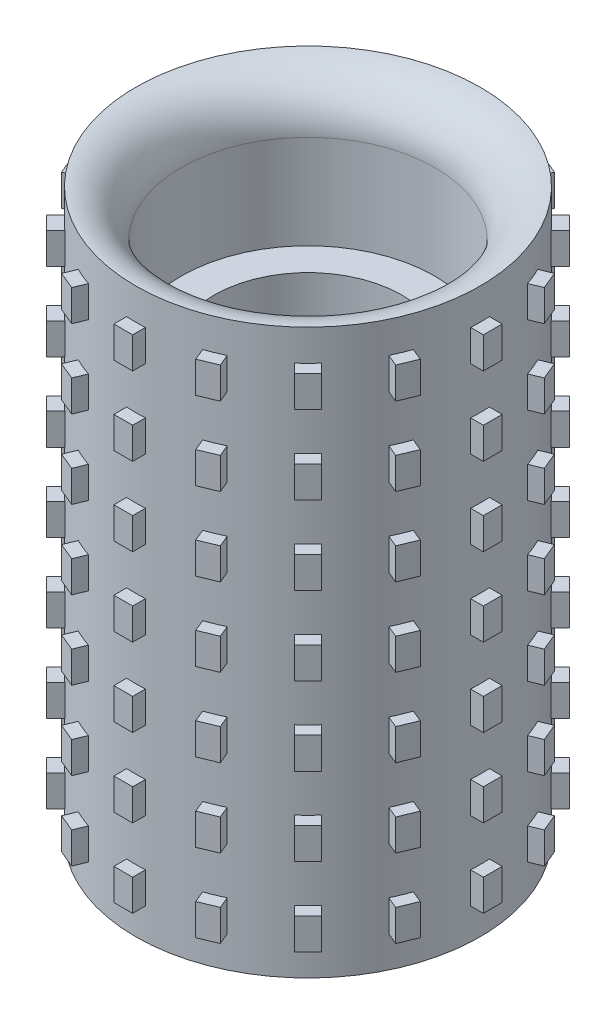
from build123d import *

# Parameters (mm, degrees)
SKETCH1_R            = 11
BOSS_EXTRUDE1_DEPTH  = 18
SKETCH2_R            = 6
CUT_EXTRUDE1_DEPTH   = 9
SKETCH3_R            = 8.1
CUT_EXTRUDE2_DEPTH   = 9
FILLET1_R            = 3
FILLET1_OF_MIRROR2_R = 3
BOSS_EXTRUDE2_DEPTH  = 1
LPATTERN2_COUNT      = 4
LPATTERN2_PITCH      = 5
MIRROR3_COPY_1_DEPTH = 1
MIRROR3_COPY_2_DEPTH = 1
MIRROR3_COPY_3_DEPTH = 1
MIRROR3_COPY_4_DEPTH = 1


with BuildPart() as part:
    # Sketch1 → Boss-Extrude1 (new, symmetric)
    with BuildSketch(Plane(origin=(0, 0, 0), x_dir=(1, 0, 0), z_dir=(0, 1, 0))):
        with Locations(Location((0, 0, 0), (0, 0, 270))):
            Circle(SKETCH1_R)
    extrude(amount=BOSS_EXTRUDE1_DEPTH, both=True)

    # Sketch2 → Cut-Extrude1 (cut, symmetric)
    with BuildSketch(Plane(origin=(0, 0, 0), x_dir=(1, 0, 0), z_dir=(0, 1, 0))):
        with Locations(Location((0, 0, 0), (0, 0, 270))):
            Circle(SKETCH2_R)
    extrude(amount=CUT_EXTRUDE1_DEPTH, both=True, mode=Mode.SUBTRACT)

    # Sketch3 → Cut-Extrude2 (cut)
    with BuildSketch(Plane.XZ.offset(18)):
        with Locations(Location((0, 0, 0), (0, 0, 270))):
            Circle(SKETCH3_R)
    cut_extrude2 = extrude(amount=-CUT_EXTRUDE2_DEPTH, mode=Mode.SUBTRACT)

    # Fillet1
    # the kernel refuses this fillet: 3 mm, written as the material it takes off along each edge
    with BuildSketch(Plane(origin=(0, -18, 0), x_dir=(-1.8e-16, 0, -1), z_dir=(-1, 0, 1.8e-16))) as fillet1_piece_1:
        with BuildLine():
            CenterArc((11.1, -2.998332870112989), FILLET1_R, 91.91021317170993, 88.08978682829007)
            Line((8.1, -2.998332870112989), (8.04, -2.998332870112989))
            Line((8.04, -2.998332870112989), (8.04, 0))
            Line((8.04, 0), (8.1, 0.05999999999999872))
            ThreePointArc((8.1, 0.05999999999999872), (9.55, 0.05999999999999872), (10.998, 0.05996665740225993))
            Line((10.998, 0.05996665740225993), (11, 0))
        make_face()
    revolve(axis=Axis((0, -18, 0), (0, -1, 0)), mode=Mode.SUBTRACT)

    # Mirror2: Cut-Extrude2 across plane
    add(cut_extrude2.mirror(Plane.ZX), mode=Mode.SUBTRACT)

    # Fillet1 of Mirror2
    # the kernel refuses this fillet: 3 mm, written as the material it takes off along each edge
    with BuildSketch(Plane(origin=(0, 18, 0), x_dir=(-1.8e-16, 0, -1), z_dir=(-1, 0, 1.8e-16))) as fillet1_of_mirror2_piece_1:
        with BuildLine():
            CenterArc((11.1, 2.998332870112989), FILLET1_OF_MIRROR2_R, 180, 88.08978682829007)
            Line((8.1, 2.998332870112989), (8.04, 2.998332870112989))
            Line((8.04, 2.998332870112989), (8.04, 0))
            Line((8.04, 0), (8.1, -0.05999999999999872))
            ThreePointArc((8.1, -0.05999999999999872), (9.55, -0.05999999999999872), (10.998, -0.05996665740225993))
            Line((10.998, -0.05996665740225993), (11, 0))
        make_face()
    revolve(axis=Axis((0, 18, 0), (0, -1, 0)), mode=Mode.SUBTRACT)

    # Sketch4 → Boss-Extrude2 (add, symmetric)
    with BuildSketch(Plane(origin=(0, 0, 0), x_dir=(1, 0, 0), z_dir=(0, 1, 0))):
        with BuildLine():
            Line((-0.6, 10.983624174196784), (-0.6, 11.799999999999999))
            Line((-0.6, 11.799999999999999), (0.6, 11.799999999999999))
            Line((0.6, 11.799999999999999), (0.6, 10.983624174196784))
            ThreePointArc((0.6, 10.983624174196784), (6.7e-16, 11), (-0.6, 10.983624174196784))
        make_face()
        with BuildLine():
            Line((3.648923279283037, 10.377155626755648), (3.961336782401297, 11.131388543052237))
            Line((3.961336782401297, 11.131388543052237), (5.069992221414841, 10.672168424214128))
            Line((5.069992221414841, 10.672168424214128), (4.757578718296581, 9.917935507917539))
            ThreePointArc((4.757578718296581, 9.917935507917539), (4.209517756015996, 10.162674857624156), (3.648923279283037, 10.377155626755648))
        make_face()
        with BuildLine():
            Line((7.342331066867124, 8.190859204290955), (7.919595949289347, 8.768124086713176))
            Line((7.919595949289347, 8.768124086713176), (8.7681240867132, 7.919595949289317))
            Line((8.7681240867132, 7.919595949289317), (8.190859204290982, 7.342331066867097))
            ThreePointArc((8.190859204290982, 7.342331066867097), (7.778174593052037, 7.778174593052011), (7.342331066867124, 8.190859204290955))
        make_face()
        with BuildLine():
            Line((9.917935507917552, 4.757578718296545), (10.672168424214142, 5.069992221414804))
            Line((10.672168424214142, 5.069992221414804), (11.131388543052248, 3.9613367824012578))
            Line((11.131388543052248, 3.9613367824012578), (10.377155626755657, 3.648923279283001))
            ThreePointArc((10.377155626755657, 3.648923279283001), (10.162674857624165, 4.20951775601596), (9.917935507917552, 4.757578718296545))
        make_face()
        with BuildLine():
            Line((10.983624174196786, 0.5999999999999616), (11.8, 0.5999999999999588))
            Line((11.8, 0.5999999999999588), (11.799999999999997, -0.6000000000000412))
            Line((11.799999999999997, -0.6000000000000412), (10.983624174196782, -0.6000000000000383))
            ThreePointArc((10.983624174196782, -0.6000000000000383), (11, -3.839e-14), (10.983624174196786, 0.5999999999999616))
        make_face()
        with BuildLine():
            Line((10.377155626755634, -3.6489232792830735), (11.131388543052221, -3.961336782401336))
            Line((11.131388543052221, -3.961336782401336), (10.672168424214108, -5.0699922214148785))
            Line((10.672168424214108, -5.0699922214148785), (9.917935507917521, -4.757578718296616))
            ThreePointArc((9.917935507917521, -4.757578718296616), (10.162674857624138, -4.209517756016032), (10.377155626755634, -3.6489232792830735))
        make_face()
        with BuildLine():
            Line((8.19085920429093, -7.342331066867154), (8.768124086713147, -7.91959594928938))
            Line((8.768124086713147, -7.91959594928938), (7.919595949289286, -8.76812408671323))
            Line((7.919595949289286, -8.76812408671323), (7.342331066867068, -8.190859204291005))
            ThreePointArc((7.342331066867068, -8.190859204291005), (7.778174593051982, -7.7781745930520625), (8.19085920429093, -7.342331066867154))
        make_face()
        with BuildLine():
            Line((4.757578718296511, -9.917935507917568), (5.069992221414766, -10.67216842421416))
            Line((5.069992221414766, -10.67216842421416), (3.9613367824012196, -11.131388543052262))
            Line((3.9613367824012196, -11.131388543052262), (3.6489232792829647, -10.377155626755671))
            ThreePointArc((3.6489232792829647, -10.377155626755671), (4.209517756015925, -10.16267485762418), (4.757578718296511, -9.917935507917568))
        make_face()
        with BuildLine():
            Line((0.599999999999923, -10.983624174196787), (0.5999999999999174, -11.800000000000002))
            Line((0.5999999999999174, -11.800000000000002), (-0.6000000000000826, -11.799999999999995))
            Line((-0.6000000000000826, -11.799999999999995), (-0.6000000000000768, -10.98362417419678))
            ThreePointArc((-0.6000000000000768, -10.98362417419678), (-7.749e-14, -11), (0.599999999999923, -10.983624174196787))
        make_face()
        with BuildLine():
            Line((-3.648923279283108, -10.377155626755611), (-3.961336782401373, -11.1313885430522))
            Line((-3.961336782401373, -11.1313885430522), (-5.069992221414914, -10.672168424214084))
            Line((-5.069992221414914, -10.672168424214084), (-4.7575787182966485, -9.917935507917495))
            ThreePointArc((-4.7575787182966485, -9.917935507917495), (-4.209517756016066, -10.162674857624115), (-3.648923279283108, -10.377155626755611))
        make_face()
        with BuildLine():
            Line((-7.342331066867183, -8.190859204290902), (-7.919595949289409, -8.768124086713119))
            Line((-7.919595949289409, -8.768124086713119), (-8.768124086713257, -7.919595949289253))
            Line((-8.768124086713257, -7.919595949289253), (-8.190859204291032, -7.342331066867038))
            ThreePointArc((-8.190859204291032, -7.342331066867038), (-7.77817459305209, -7.778174593051953), (-7.342331066867183, -8.190859204290902))
        make_face()
        with BuildLine():
            Line((-9.917935507917587, -4.757578718296473), (-10.672168424214183, -5.069992221414724))
            Line((-10.672168424214183, -5.069992221414724), (-11.131388543052278, -3.961336782401176))
            Line((-11.131388543052278, -3.961336782401176), (-10.377155626755682, -3.6489232792829247))
            ThreePointArc((-10.377155626755682, -3.6489232792829247), (-10.162674857624195, -4.2095177560158845), (-9.917935507917587, -4.757578718296473))
        make_face()
        with BuildLine():
            Line((-10.983624174196791, -0.599999999999885), (-11.800000000000006, -0.5999999999998763))
            Line((-11.800000000000006, -0.5999999999998763), (-11.799999999999994, 0.6000000000001235))
            Line((-11.799999999999994, 0.6000000000001235), (-10.983624174196777, 0.600000000000115))
            ThreePointArc((-10.983624174196777, 0.600000000000115), (-10.999999999999998, 1.1859e-13), (-10.983624174196791, -0.599999999999885))
        make_face()
        with BuildLine():
            Line((-10.377155626755608, 3.6489232792831374), (-11.131388543052195, 3.961336782401405))
            Line((-11.131388543052195, 3.961336782401405), (-10.672168424214075, 5.069992221414944))
            Line((-10.672168424214075, 5.069992221414944), (-9.91793550791749, 4.757578718296677))
            ThreePointArc((-9.91793550791749, 4.757578718296677), (-10.162674857624111, 4.209517756016092), (-10.377155626755608, 3.6489232792831374))
        make_face()
        with BuildLine():
            Line((-8.19085920429088, 7.342331066867211), (-8.768124086713094, 7.919595949289438))
            Line((-8.768124086713094, 7.919595949289438), (-7.919595949289225, 8.768124086713286))
            Line((-7.919595949289225, 8.768124086713286), (-7.342331066867012, 8.190859204291058))
            ThreePointArc((-7.342331066867012, 8.190859204291058), (-7.77817459305193, 7.7781745930521184), (-8.19085920429088, 7.342331066867211))
        make_face()
        with BuildLine():
            Line((-4.757578718296438, 9.917935507917607), (-5.069992221414687, 10.6721684242142))
            Line((-5.069992221414687, 10.6721684242142), (-3.961336782401137, 11.131388543052292))
            Line((-3.961336782401137, 11.131388543052292), (-3.6489232792828883, 10.377155626755698))
            ThreePointArc((-3.6489232792828883, 10.377155626755698), (-4.20951775601585, 10.162674857624213), (-4.757578718296438, 9.917935507917607))
        make_face()
    boss_extrude2 = extrude(amount=BOSS_EXTRUDE2_DEPTH, both=True)

    # LPattern2: Boss-Extrude2 ×4
    with Locations(*[(0, i * LPATTERN2_PITCH, 0) for i in range(1, LPATTERN2_COUNT)]):
        add(boss_extrude2)

    # Mirror3 copy 1 sketch → Mirror3 copy 1 (add, symmetric)
    with BuildSketch(Plane.XZ.offset(5)):
        with BuildLine():
            Line((-0.6, -10.983624174196784), (-0.6, -11.799999999999999))
            Line((-0.6, -11.799999999999999), (0.6, -11.799999999999999))
            Line((0.6, -11.799999999999999), (0.6, -10.983624174196784))
            ThreePointArc((0.6, -10.983624174196784), (6.7e-16, -11), (-0.6, -10.983624174196784))
        make_face()
        with BuildLine():
            Line((3.648923279283037, -10.377155626755648), (3.961336782401297, -11.131388543052237))
            Line((3.961336782401297, -11.131388543052237), (5.069992221414841, -10.672168424214128))
            Line((5.069992221414841, -10.672168424214128), (4.757578718296581, -9.917935507917539))
            ThreePointArc((4.757578718296581, -9.917935507917539), (4.209517756015996, -10.162674857624156), (3.648923279283037, -10.377155626755648))
        make_face()
        with BuildLine():
            Line((7.342331066867124, -8.190859204290955), (7.919595949289347, -8.768124086713176))
            Line((7.919595949289347, -8.768124086713176), (8.7681240867132, -7.919595949289317))
            Line((8.7681240867132, -7.919595949289317), (8.190859204290982, -7.342331066867097))
            ThreePointArc((8.190859204290982, -7.342331066867097), (7.778174593052037, -7.778174593052011), (7.342331066867124, -8.190859204290955))
        make_face()
        with BuildLine():
            Line((9.917935507917552, -4.757578718296545), (10.672168424214142, -5.069992221414804))
            Line((10.672168424214142, -5.069992221414804), (11.131388543052248, -3.9613367824012578))
            Line((11.131388543052248, -3.9613367824012578), (10.377155626755657, -3.648923279283001))
            ThreePointArc((10.377155626755657, -3.648923279283001), (10.162674857624165, -4.20951775601596), (9.917935507917552, -4.757578718296545))
        make_face()
        with BuildLine():
            Line((10.983624174196786, -0.5999999999999616), (11.8, -0.5999999999999588))
            Line((11.8, -0.5999999999999588), (11.799999999999997, 0.6000000000000412))
            Line((11.799999999999997, 0.6000000000000412), (10.983624174196782, 0.6000000000000383))
            ThreePointArc((10.983624174196782, 0.6000000000000383), (11, 3.839e-14), (10.983624174196786, -0.5999999999999616))
        make_face()
        with BuildLine():
            Line((10.377155626755634, 3.6489232792830735), (11.131388543052221, 3.961336782401336))
            Line((11.131388543052221, 3.961336782401336), (10.672168424214108, 5.0699922214148785))
            Line((10.672168424214108, 5.0699922214148785), (9.917935507917521, 4.757578718296616))
            ThreePointArc((9.917935507917521, 4.757578718296616), (10.162674857624138, 4.209517756016032), (10.377155626755634, 3.6489232792830735))
        make_face()
        with BuildLine():
            Line((8.19085920429093, 7.342331066867154), (8.768124086713147, 7.91959594928938))
            Line((8.768124086713147, 7.91959594928938), (7.919595949289286, 8.76812408671323))
            Line((7.919595949289286, 8.76812408671323), (7.342331066867068, 8.190859204291005))
            ThreePointArc((7.342331066867068, 8.190859204291005), (7.778174593051982, 7.7781745930520625), (8.19085920429093, 7.342331066867154))
        make_face()
        with BuildLine():
            Line((4.757578718296511, 9.917935507917568), (5.069992221414766, 10.67216842421416))
            Line((5.069992221414766, 10.67216842421416), (3.9613367824012196, 11.131388543052262))
            Line((3.9613367824012196, 11.131388543052262), (3.6489232792829647, 10.377155626755671))
            ThreePointArc((3.6489232792829647, 10.377155626755671), (4.209517756015925, 10.16267485762418), (4.757578718296511, 9.917935507917568))
        make_face()
        with BuildLine():
            Line((0.599999999999923, 10.983624174196787), (0.5999999999999174, 11.800000000000002))
            Line((0.5999999999999174, 11.800000000000002), (-0.6000000000000826, 11.799999999999995))
            Line((-0.6000000000000826, 11.799999999999995), (-0.6000000000000768, 10.98362417419678))
            ThreePointArc((-0.6000000000000768, 10.98362417419678), (-7.749e-14, 11), (0.599999999999923, 10.983624174196787))
        make_face()
        with BuildLine():
            Line((-3.648923279283108, 10.377155626755611), (-3.961336782401373, 11.1313885430522))
            Line((-3.961336782401373, 11.1313885430522), (-5.069992221414914, 10.672168424214084))
            Line((-5.069992221414914, 10.672168424214084), (-4.7575787182966485, 9.917935507917495))
            ThreePointArc((-4.7575787182966485, 9.917935507917495), (-4.209517756016066, 10.162674857624115), (-3.648923279283108, 10.377155626755611))
        make_face()
        with BuildLine():
            Line((-7.342331066867183, 8.190859204290902), (-7.919595949289409, 8.768124086713119))
            Line((-7.919595949289409, 8.768124086713119), (-8.768124086713257, 7.919595949289253))
            Line((-8.768124086713257, 7.919595949289253), (-8.190859204291032, 7.342331066867038))
            ThreePointArc((-8.190859204291032, 7.342331066867038), (-7.77817459305209, 7.778174593051953), (-7.342331066867183, 8.190859204290902))
        make_face()
        with BuildLine():
            Line((-9.917935507917587, 4.757578718296473), (-10.672168424214183, 5.069992221414724))
            Line((-10.672168424214183, 5.069992221414724), (-11.131388543052278, 3.961336782401176))
            Line((-11.131388543052278, 3.961336782401176), (-10.377155626755682, 3.6489232792829247))
            ThreePointArc((-10.377155626755682, 3.6489232792829247), (-10.162674857624195, 4.2095177560158845), (-9.917935507917587, 4.757578718296473))
        make_face()
        with BuildLine():
            Line((-10.983624174196791, 0.599999999999885), (-11.800000000000006, 0.5999999999998763))
            Line((-11.800000000000006, 0.5999999999998763), (-11.799999999999994, -0.6000000000001235))
            Line((-11.799999999999994, -0.6000000000001235), (-10.983624174196777, -0.600000000000115))
            ThreePointArc((-10.983624174196777, -0.600000000000115), (-10.999999999999998, -1.1859e-13), (-10.983624174196791, 0.599999999999885))
        make_face()
        with BuildLine():
            Line((-10.377155626755608, -3.6489232792831374), (-11.131388543052195, -3.961336782401405))
            Line((-11.131388543052195, -3.961336782401405), (-10.672168424214075, -5.069992221414944))
            Line((-10.672168424214075, -5.069992221414944), (-9.91793550791749, -4.757578718296677))
            ThreePointArc((-9.91793550791749, -4.757578718296677), (-10.162674857624111, -4.209517756016092), (-10.377155626755608, -3.6489232792831374))
        make_face()
        with BuildLine():
            Line((-8.19085920429088, -7.342331066867211), (-8.768124086713094, -7.919595949289438))
            Line((-8.768124086713094, -7.919595949289438), (-7.919595949289225, -8.768124086713286))
            Line((-7.919595949289225, -8.768124086713286), (-7.342331066867012, -8.190859204291058))
            ThreePointArc((-7.342331066867012, -8.190859204291058), (-7.77817459305193, -7.7781745930521184), (-8.19085920429088, -7.342331066867211))
        make_face()
        with BuildLine():
            Line((-4.757578718296438, -9.917935507917607), (-5.069992221414687, -10.6721684242142))
            Line((-5.069992221414687, -10.6721684242142), (-3.961336782401137, -11.131388543052292))
            Line((-3.961336782401137, -11.131388543052292), (-3.6489232792828883, -10.377155626755698))
            ThreePointArc((-3.6489232792828883, -10.377155626755698), (-4.20951775601585, -10.162674857624213), (-4.757578718296438, -9.917935507917607))
        make_face()
    extrude(amount=MIRROR3_COPY_1_DEPTH, both=True)

    # Mirror3 copy 2 sketch → Mirror3 copy 2 (add, symmetric)
    with BuildSketch(Plane.XZ.offset(10)):
        with BuildLine():
            Line((-0.6, -10.983624174196784), (-0.6, -11.799999999999999))
            Line((-0.6, -11.799999999999999), (0.6, -11.799999999999999))
            Line((0.6, -11.799999999999999), (0.6, -10.983624174196784))
            ThreePointArc((0.6, -10.983624174196784), (6.7e-16, -11), (-0.6, -10.983624174196784))
        make_face()
        with BuildLine():
            Line((3.648923279283037, -10.377155626755648), (3.961336782401297, -11.131388543052237))
            Line((3.961336782401297, -11.131388543052237), (5.069992221414841, -10.672168424214128))
            Line((5.069992221414841, -10.672168424214128), (4.757578718296581, -9.917935507917539))
            ThreePointArc((4.757578718296581, -9.917935507917539), (4.209517756015996, -10.162674857624156), (3.648923279283037, -10.377155626755648))
        make_face()
        with BuildLine():
            Line((7.342331066867124, -8.190859204290955), (7.919595949289347, -8.768124086713176))
            Line((7.919595949289347, -8.768124086713176), (8.7681240867132, -7.919595949289317))
            Line((8.7681240867132, -7.919595949289317), (8.190859204290982, -7.342331066867097))
            ThreePointArc((8.190859204290982, -7.342331066867097), (7.778174593052037, -7.778174593052011), (7.342331066867124, -8.190859204290955))
        make_face()
        with BuildLine():
            Line((9.917935507917552, -4.757578718296545), (10.672168424214142, -5.069992221414804))
            Line((10.672168424214142, -5.069992221414804), (11.131388543052248, -3.9613367824012578))
            Line((11.131388543052248, -3.9613367824012578), (10.377155626755657, -3.648923279283001))
            ThreePointArc((10.377155626755657, -3.648923279283001), (10.162674857624165, -4.20951775601596), (9.917935507917552, -4.757578718296545))
        make_face()
        with BuildLine():
            Line((10.983624174196786, -0.5999999999999616), (11.8, -0.5999999999999588))
            Line((11.8, -0.5999999999999588), (11.799999999999997, 0.6000000000000412))
            Line((11.799999999999997, 0.6000000000000412), (10.983624174196782, 0.6000000000000383))
            ThreePointArc((10.983624174196782, 0.6000000000000383), (11, 3.839e-14), (10.983624174196786, -0.5999999999999616))
        make_face()
        with BuildLine():
            Line((10.377155626755634, 3.6489232792830735), (11.131388543052221, 3.961336782401336))
            Line((11.131388543052221, 3.961336782401336), (10.672168424214108, 5.0699922214148785))
            Line((10.672168424214108, 5.0699922214148785), (9.917935507917521, 4.757578718296616))
            ThreePointArc((9.917935507917521, 4.757578718296616), (10.162674857624138, 4.209517756016032), (10.377155626755634, 3.6489232792830735))
        make_face()
        with BuildLine():
            Line((8.19085920429093, 7.342331066867154), (8.768124086713147, 7.91959594928938))
            Line((8.768124086713147, 7.91959594928938), (7.919595949289286, 8.76812408671323))
            Line((7.919595949289286, 8.76812408671323), (7.342331066867068, 8.190859204291005))
            ThreePointArc((7.342331066867068, 8.190859204291005), (7.778174593051982, 7.7781745930520625), (8.19085920429093, 7.342331066867154))
        make_face()
        with BuildLine():
            Line((4.757578718296511, 9.917935507917568), (5.069992221414766, 10.67216842421416))
            Line((5.069992221414766, 10.67216842421416), (3.9613367824012196, 11.131388543052262))
            Line((3.9613367824012196, 11.131388543052262), (3.6489232792829647, 10.377155626755671))
            ThreePointArc((3.6489232792829647, 10.377155626755671), (4.209517756015925, 10.16267485762418), (4.757578718296511, 9.917935507917568))
        make_face()
        with BuildLine():
            Line((0.599999999999923, 10.983624174196787), (0.5999999999999174, 11.800000000000002))
            Line((0.5999999999999174, 11.800000000000002), (-0.6000000000000826, 11.799999999999995))
            Line((-0.6000000000000826, 11.799999999999995), (-0.6000000000000768, 10.98362417419678))
            ThreePointArc((-0.6000000000000768, 10.98362417419678), (-7.749e-14, 11), (0.599999999999923, 10.983624174196787))
        make_face()
        with BuildLine():
            Line((-3.648923279283108, 10.377155626755611), (-3.961336782401373, 11.1313885430522))
            Line((-3.961336782401373, 11.1313885430522), (-5.069992221414914, 10.672168424214084))
            Line((-5.069992221414914, 10.672168424214084), (-4.7575787182966485, 9.917935507917495))
            ThreePointArc((-4.7575787182966485, 9.917935507917495), (-4.209517756016066, 10.162674857624115), (-3.648923279283108, 10.377155626755611))
        make_face()
        with BuildLine():
            Line((-7.342331066867183, 8.190859204290902), (-7.919595949289409, 8.768124086713119))
            Line((-7.919595949289409, 8.768124086713119), (-8.768124086713257, 7.919595949289253))
            Line((-8.768124086713257, 7.919595949289253), (-8.190859204291032, 7.342331066867038))
            ThreePointArc((-8.190859204291032, 7.342331066867038), (-7.77817459305209, 7.778174593051953), (-7.342331066867183, 8.190859204290902))
        make_face()
        with BuildLine():
            Line((-9.917935507917587, 4.757578718296473), (-10.672168424214183, 5.069992221414724))
            Line((-10.672168424214183, 5.069992221414724), (-11.131388543052278, 3.961336782401176))
            Line((-11.131388543052278, 3.961336782401176), (-10.377155626755682, 3.6489232792829247))
            ThreePointArc((-10.377155626755682, 3.6489232792829247), (-10.162674857624195, 4.2095177560158845), (-9.917935507917587, 4.757578718296473))
        make_face()
        with BuildLine():
            Line((-10.983624174196791, 0.599999999999885), (-11.800000000000006, 0.5999999999998763))
            Line((-11.800000000000006, 0.5999999999998763), (-11.799999999999994, -0.6000000000001235))
            Line((-11.799999999999994, -0.6000000000001235), (-10.983624174196777, -0.600000000000115))
            ThreePointArc((-10.983624174196777, -0.600000000000115), (-10.999999999999998, -1.1859e-13), (-10.983624174196791, 0.599999999999885))
        make_face()
        with BuildLine():
            Line((-10.377155626755608, -3.6489232792831374), (-11.131388543052195, -3.961336782401405))
            Line((-11.131388543052195, -3.961336782401405), (-10.672168424214075, -5.069992221414944))
            Line((-10.672168424214075, -5.069992221414944), (-9.91793550791749, -4.757578718296677))
            ThreePointArc((-9.91793550791749, -4.757578718296677), (-10.162674857624111, -4.209517756016092), (-10.377155626755608, -3.6489232792831374))
        make_face()
        with BuildLine():
            Line((-8.19085920429088, -7.342331066867211), (-8.768124086713094, -7.919595949289438))
            Line((-8.768124086713094, -7.919595949289438), (-7.919595949289225, -8.768124086713286))
            Line((-7.919595949289225, -8.768124086713286), (-7.342331066867012, -8.190859204291058))
            ThreePointArc((-7.342331066867012, -8.190859204291058), (-7.77817459305193, -7.7781745930521184), (-8.19085920429088, -7.342331066867211))
        make_face()
        with BuildLine():
            Line((-4.757578718296438, -9.917935507917607), (-5.069992221414687, -10.6721684242142))
            Line((-5.069992221414687, -10.6721684242142), (-3.961336782401137, -11.131388543052292))
            Line((-3.961336782401137, -11.131388543052292), (-3.6489232792828883, -10.377155626755698))
            ThreePointArc((-3.6489232792828883, -10.377155626755698), (-4.20951775601585, -10.162674857624213), (-4.757578718296438, -9.917935507917607))
        make_face()
    extrude(amount=MIRROR3_COPY_2_DEPTH, both=True)

    # Mirror3 copy 3 sketch → Mirror3 copy 3 (add, symmetric)
    with BuildSketch(Plane.XZ.offset(15)):
        with BuildLine():
            Line((-0.6, -10.983624174196784), (-0.6, -11.799999999999999))
            Line((-0.6, -11.799999999999999), (0.6, -11.799999999999999))
            Line((0.6, -11.799999999999999), (0.6, -10.983624174196784))
            ThreePointArc((0.6, -10.983624174196784), (6.7e-16, -11), (-0.6, -10.983624174196784))
        make_face()
        with BuildLine():
            Line((3.648923279283037, -10.377155626755648), (3.961336782401297, -11.131388543052237))
            Line((3.961336782401297, -11.131388543052237), (5.069992221414841, -10.672168424214128))
            Line((5.069992221414841, -10.672168424214128), (4.757578718296581, -9.917935507917539))
            ThreePointArc((4.757578718296581, -9.917935507917539), (4.209517756015996, -10.162674857624156), (3.648923279283037, -10.377155626755648))
        make_face()
        with BuildLine():
            Line((7.342331066867124, -8.190859204290955), (7.919595949289347, -8.768124086713176))
            Line((7.919595949289347, -8.768124086713176), (8.7681240867132, -7.919595949289317))
            Line((8.7681240867132, -7.919595949289317), (8.190859204290982, -7.342331066867097))
            ThreePointArc((8.190859204290982, -7.342331066867097), (7.778174593052037, -7.778174593052011), (7.342331066867124, -8.190859204290955))
        make_face()
        with BuildLine():
            Line((9.917935507917552, -4.757578718296545), (10.672168424214142, -5.069992221414804))
            Line((10.672168424214142, -5.069992221414804), (11.131388543052248, -3.9613367824012578))
            Line((11.131388543052248, -3.9613367824012578), (10.377155626755657, -3.648923279283001))
            ThreePointArc((10.377155626755657, -3.648923279283001), (10.162674857624165, -4.20951775601596), (9.917935507917552, -4.757578718296545))
        make_face()
        with BuildLine():
            Line((10.983624174196786, -0.5999999999999616), (11.8, -0.5999999999999588))
            Line((11.8, -0.5999999999999588), (11.799999999999997, 0.6000000000000412))
            Line((11.799999999999997, 0.6000000000000412), (10.983624174196782, 0.6000000000000383))
            ThreePointArc((10.983624174196782, 0.6000000000000383), (11, 3.839e-14), (10.983624174196786, -0.5999999999999616))
        make_face()
        with BuildLine():
            Line((10.377155626755634, 3.6489232792830735), (11.131388543052221, 3.961336782401336))
            Line((11.131388543052221, 3.961336782401336), (10.672168424214108, 5.0699922214148785))
            Line((10.672168424214108, 5.0699922214148785), (9.917935507917521, 4.757578718296616))
            ThreePointArc((9.917935507917521, 4.757578718296616), (10.162674857624138, 4.209517756016032), (10.377155626755634, 3.6489232792830735))
        make_face()
        with BuildLine():
            Line((8.19085920429093, 7.342331066867154), (8.768124086713147, 7.91959594928938))
            Line((8.768124086713147, 7.91959594928938), (7.919595949289286, 8.76812408671323))
            Line((7.919595949289286, 8.76812408671323), (7.342331066867068, 8.190859204291005))
            ThreePointArc((7.342331066867068, 8.190859204291005), (7.778174593051982, 7.7781745930520625), (8.19085920429093, 7.342331066867154))
        make_face()
        with BuildLine():
            Line((4.757578718296511, 9.917935507917568), (5.069992221414766, 10.67216842421416))
            Line((5.069992221414766, 10.67216842421416), (3.9613367824012196, 11.131388543052262))
            Line((3.9613367824012196, 11.131388543052262), (3.6489232792829647, 10.377155626755671))
            ThreePointArc((3.6489232792829647, 10.377155626755671), (4.209517756015925, 10.16267485762418), (4.757578718296511, 9.917935507917568))
        make_face()
        with BuildLine():
            Line((0.599999999999923, 10.983624174196787), (0.5999999999999174, 11.800000000000002))
            Line((0.5999999999999174, 11.800000000000002), (-0.6000000000000826, 11.799999999999995))
            Line((-0.6000000000000826, 11.799999999999995), (-0.6000000000000768, 10.98362417419678))
            ThreePointArc((-0.6000000000000768, 10.98362417419678), (-7.749e-14, 11), (0.599999999999923, 10.983624174196787))
        make_face()
        with BuildLine():
            Line((-3.648923279283108, 10.377155626755611), (-3.961336782401373, 11.1313885430522))
            Line((-3.961336782401373, 11.1313885430522), (-5.069992221414914, 10.672168424214084))
            Line((-5.069992221414914, 10.672168424214084), (-4.7575787182966485, 9.917935507917495))
            ThreePointArc((-4.7575787182966485, 9.917935507917495), (-4.209517756016066, 10.162674857624115), (-3.648923279283108, 10.377155626755611))
        make_face()
        with BuildLine():
            Line((-7.342331066867183, 8.190859204290902), (-7.919595949289409, 8.768124086713119))
            Line((-7.919595949289409, 8.768124086713119), (-8.768124086713257, 7.919595949289253))
            Line((-8.768124086713257, 7.919595949289253), (-8.190859204291032, 7.342331066867038))
            ThreePointArc((-8.190859204291032, 7.342331066867038), (-7.77817459305209, 7.778174593051953), (-7.342331066867183, 8.190859204290902))
        make_face()
        with BuildLine():
            Line((-9.917935507917587, 4.757578718296473), (-10.672168424214183, 5.069992221414724))
            Line((-10.672168424214183, 5.069992221414724), (-11.131388543052278, 3.961336782401176))
            Line((-11.131388543052278, 3.961336782401176), (-10.377155626755682, 3.6489232792829247))
            ThreePointArc((-10.377155626755682, 3.6489232792829247), (-10.162674857624195, 4.2095177560158845), (-9.917935507917587, 4.757578718296473))
        make_face()
        with BuildLine():
            Line((-10.983624174196791, 0.599999999999885), (-11.800000000000006, 0.5999999999998763))
            Line((-11.800000000000006, 0.5999999999998763), (-11.799999999999994, -0.6000000000001235))
            Line((-11.799999999999994, -0.6000000000001235), (-10.983624174196777, -0.600000000000115))
            ThreePointArc((-10.983624174196777, -0.600000000000115), (-10.999999999999998, -1.1859e-13), (-10.983624174196791, 0.599999999999885))
        make_face()
        with BuildLine():
            Line((-10.377155626755608, -3.6489232792831374), (-11.131388543052195, -3.961336782401405))
            Line((-11.131388543052195, -3.961336782401405), (-10.672168424214075, -5.069992221414944))
            Line((-10.672168424214075, -5.069992221414944), (-9.91793550791749, -4.757578718296677))
            ThreePointArc((-9.91793550791749, -4.757578718296677), (-10.162674857624111, -4.209517756016092), (-10.377155626755608, -3.6489232792831374))
        make_face()
        with BuildLine():
            Line((-8.19085920429088, -7.342331066867211), (-8.768124086713094, -7.919595949289438))
            Line((-8.768124086713094, -7.919595949289438), (-7.919595949289225, -8.768124086713286))
            Line((-7.919595949289225, -8.768124086713286), (-7.342331066867012, -8.190859204291058))
            ThreePointArc((-7.342331066867012, -8.190859204291058), (-7.77817459305193, -7.7781745930521184), (-8.19085920429088, -7.342331066867211))
        make_face()
        with BuildLine():
            Line((-4.757578718296438, -9.917935507917607), (-5.069992221414687, -10.6721684242142))
            Line((-5.069992221414687, -10.6721684242142), (-3.961336782401137, -11.131388543052292))
            Line((-3.961336782401137, -11.131388543052292), (-3.6489232792828883, -10.377155626755698))
            ThreePointArc((-3.6489232792828883, -10.377155626755698), (-4.20951775601585, -10.162674857624213), (-4.757578718296438, -9.917935507917607))
        make_face()
    extrude(amount=MIRROR3_COPY_3_DEPTH, both=True)

    # Mirror3 copy 4 sketch → Mirror3 copy 4 (add, symmetric)
    with BuildSketch(Plane.XZ):
        with BuildLine():
            Line((-0.6, -10.983624174196784), (-0.6, -11.799999999999999))
            Line((-0.6, -11.799999999999999), (0.6, -11.799999999999999))
            Line((0.6, -11.799999999999999), (0.6, -10.983624174196784))
            ThreePointArc((0.6, -10.983624174196784), (6.7e-16, -11), (-0.6, -10.983624174196784))
        make_face()
        with BuildLine():
            Line((3.648923279283037, -10.377155626755648), (3.961336782401297, -11.131388543052237))
            Line((3.961336782401297, -11.131388543052237), (5.069992221414841, -10.672168424214128))
            Line((5.069992221414841, -10.672168424214128), (4.757578718296581, -9.917935507917539))
            ThreePointArc((4.757578718296581, -9.917935507917539), (4.209517756015996, -10.162674857624156), (3.648923279283037, -10.377155626755648))
        make_face()
        with BuildLine():
            Line((7.342331066867124, -8.190859204290955), (7.919595949289347, -8.768124086713176))
            Line((7.919595949289347, -8.768124086713176), (8.7681240867132, -7.919595949289317))
            Line((8.7681240867132, -7.919595949289317), (8.190859204290982, -7.342331066867097))
            ThreePointArc((8.190859204290982, -7.342331066867097), (7.778174593052037, -7.778174593052011), (7.342331066867124, -8.190859204290955))
        make_face()
        with BuildLine():
            Line((9.917935507917552, -4.757578718296545), (10.672168424214142, -5.069992221414804))
            Line((10.672168424214142, -5.069992221414804), (11.131388543052248, -3.9613367824012578))
            Line((11.131388543052248, -3.9613367824012578), (10.377155626755657, -3.648923279283001))
            ThreePointArc((10.377155626755657, -3.648923279283001), (10.162674857624165, -4.20951775601596), (9.917935507917552, -4.757578718296545))
        make_face()
        with BuildLine():
            Line((10.983624174196786, -0.5999999999999616), (11.8, -0.5999999999999588))
            Line((11.8, -0.5999999999999588), (11.799999999999997, 0.6000000000000412))
            Line((11.799999999999997, 0.6000000000000412), (10.983624174196782, 0.6000000000000383))
            ThreePointArc((10.983624174196782, 0.6000000000000383), (11, 3.839e-14), (10.983624174196786, -0.5999999999999616))
        make_face()
        with BuildLine():
            Line((10.377155626755634, 3.6489232792830735), (11.131388543052221, 3.961336782401336))
            Line((11.131388543052221, 3.961336782401336), (10.672168424214108, 5.0699922214148785))
            Line((10.672168424214108, 5.0699922214148785), (9.917935507917521, 4.757578718296616))
            ThreePointArc((9.917935507917521, 4.757578718296616), (10.162674857624138, 4.209517756016032), (10.377155626755634, 3.6489232792830735))
        make_face()
        with BuildLine():
            Line((8.19085920429093, 7.342331066867154), (8.768124086713147, 7.91959594928938))
            Line((8.768124086713147, 7.91959594928938), (7.919595949289286, 8.76812408671323))
            Line((7.919595949289286, 8.76812408671323), (7.342331066867068, 8.190859204291005))
            ThreePointArc((7.342331066867068, 8.190859204291005), (7.778174593051982, 7.7781745930520625), (8.19085920429093, 7.342331066867154))
        make_face()
        with BuildLine():
            Line((4.757578718296511, 9.917935507917568), (5.069992221414766, 10.67216842421416))
            Line((5.069992221414766, 10.67216842421416), (3.9613367824012196, 11.131388543052262))
            Line((3.9613367824012196, 11.131388543052262), (3.6489232792829647, 10.377155626755671))
            ThreePointArc((3.6489232792829647, 10.377155626755671), (4.209517756015925, 10.16267485762418), (4.757578718296511, 9.917935507917568))
        make_face()
        with BuildLine():
            Line((0.599999999999923, 10.983624174196787), (0.5999999999999174, 11.800000000000002))
            Line((0.5999999999999174, 11.800000000000002), (-0.6000000000000826, 11.799999999999995))
            Line((-0.6000000000000826, 11.799999999999995), (-0.6000000000000768, 10.98362417419678))
            ThreePointArc((-0.6000000000000768, 10.98362417419678), (-7.749e-14, 11), (0.599999999999923, 10.983624174196787))
        make_face()
        with BuildLine():
            Line((-3.648923279283108, 10.377155626755611), (-3.961336782401373, 11.1313885430522))
            Line((-3.961336782401373, 11.1313885430522), (-5.069992221414914, 10.672168424214084))
            Line((-5.069992221414914, 10.672168424214084), (-4.7575787182966485, 9.917935507917495))
            ThreePointArc((-4.7575787182966485, 9.917935507917495), (-4.209517756016066, 10.162674857624115), (-3.648923279283108, 10.377155626755611))
        make_face()
        with BuildLine():
            Line((-7.342331066867183, 8.190859204290902), (-7.919595949289409, 8.768124086713119))
            Line((-7.919595949289409, 8.768124086713119), (-8.768124086713257, 7.919595949289253))
            Line((-8.768124086713257, 7.919595949289253), (-8.190859204291032, 7.342331066867038))
            ThreePointArc((-8.190859204291032, 7.342331066867038), (-7.77817459305209, 7.778174593051953), (-7.342331066867183, 8.190859204290902))
        make_face()
        with BuildLine():
            Line((-9.917935507917587, 4.757578718296473), (-10.672168424214183, 5.069992221414724))
            Line((-10.672168424214183, 5.069992221414724), (-11.131388543052278, 3.961336782401176))
            Line((-11.131388543052278, 3.961336782401176), (-10.377155626755682, 3.6489232792829247))
            ThreePointArc((-10.377155626755682, 3.6489232792829247), (-10.162674857624195, 4.2095177560158845), (-9.917935507917587, 4.757578718296473))
        make_face()
        with BuildLine():
            Line((-10.983624174196791, 0.599999999999885), (-11.800000000000006, 0.5999999999998763))
            Line((-11.800000000000006, 0.5999999999998763), (-11.799999999999994, -0.6000000000001235))
            Line((-11.799999999999994, -0.6000000000001235), (-10.983624174196777, -0.600000000000115))
            ThreePointArc((-10.983624174196777, -0.600000000000115), (-10.999999999999998, -1.1859e-13), (-10.983624174196791, 0.599999999999885))
        make_face()
        with BuildLine():
            Line((-10.377155626755608, -3.6489232792831374), (-11.131388543052195, -3.961336782401405))
            Line((-11.131388543052195, -3.961336782401405), (-10.672168424214075, -5.069992221414944))
            Line((-10.672168424214075, -5.069992221414944), (-9.91793550791749, -4.757578718296677))
            ThreePointArc((-9.91793550791749, -4.757578718296677), (-10.162674857624111, -4.209517756016092), (-10.377155626755608, -3.6489232792831374))
        make_face()
        with BuildLine():
            Line((-8.19085920429088, -7.342331066867211), (-8.768124086713094, -7.919595949289438))
            Line((-8.768124086713094, -7.919595949289438), (-7.919595949289225, -8.768124086713286))
            Line((-7.919595949289225, -8.768124086713286), (-7.342331066867012, -8.190859204291058))
            ThreePointArc((-7.342331066867012, -8.190859204291058), (-7.77817459305193, -7.7781745930521184), (-8.19085920429088, -7.342331066867211))
        make_face()
        with BuildLine():
            Line((-4.757578718296438, -9.917935507917607), (-5.069992221414687, -10.6721684242142))
            Line((-5.069992221414687, -10.6721684242142), (-3.961336782401137, -11.131388543052292))
            Line((-3.961336782401137, -11.131388543052292), (-3.6489232792828883, -10.377155626755698))
            ThreePointArc((-3.6489232792828883, -10.377155626755698), (-4.20951775601585, -10.162674857624213), (-4.757578718296438, -9.917935507917607))
        make_face()
    extrude(amount=MIRROR3_COPY_4_DEPTH, both=True)


solid = part.part
